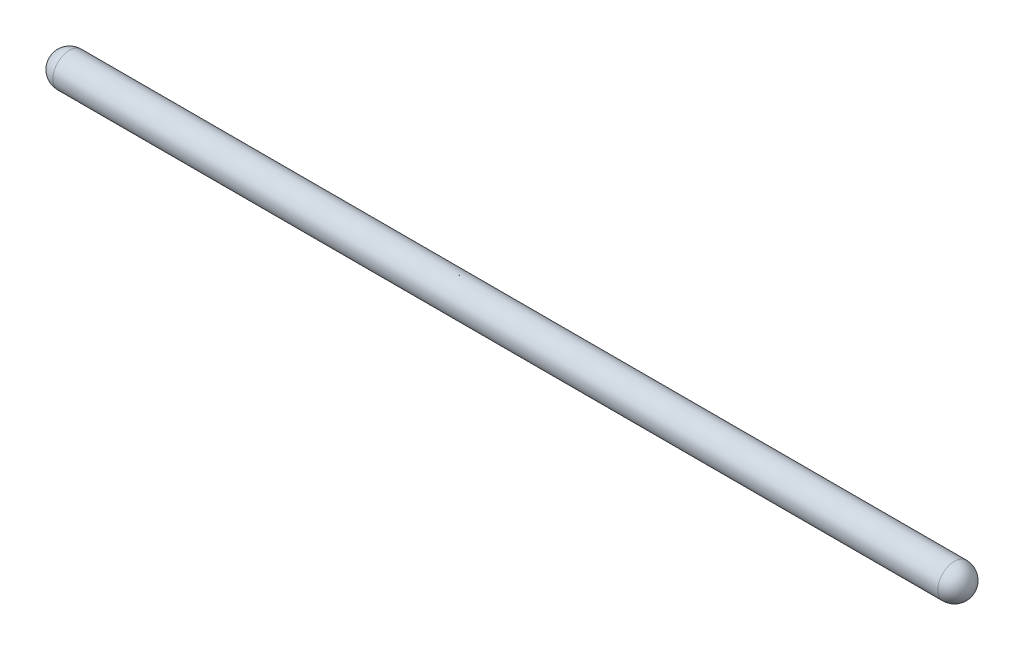
from build123d import *

# Parameters (mm, degrees)
REVOLVE1_ANGLE = 359.999695921


with BuildPart() as part:
    # Sketch1 → Revolve1 (revolve)
    with BuildSketch(Plane.XY):
        with BuildLine():
            Line((3, 3), (162, 3))
            ThreePointArc((162, 3), (164.121320344, 2.121320344), (165, 0))
            Line((165, 0), (0, 0))
            ThreePointArc((0, 0), (0.878679656, 2.121320344), (3, 3))
        make_face()
    revolve(axis=Axis((0, 0, 0), (1, 0, 0)), revolution_arc=REVOLVE1_ANGLE)


solid = part.part
